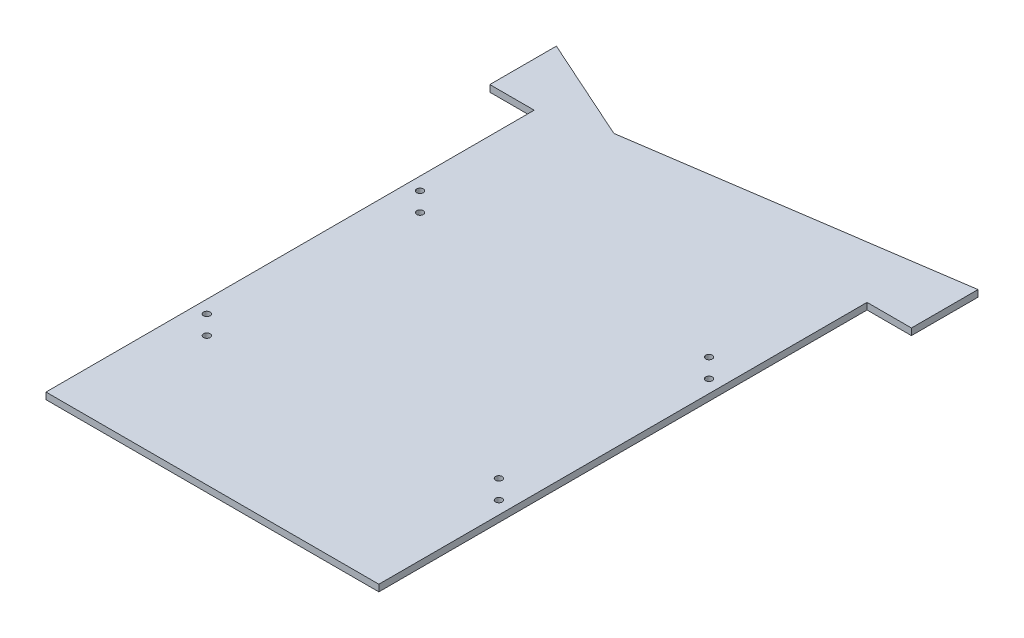
from build123d import *

# Parameters (mm, degrees)
SKETCH1_W           = 150
SKETCH1_H           = 200
SKETCH1_R           = 1.5
BOSS_EXTRUDE1_DEPTH = 3
BOSS_EXTRUDE3_DEPTH = 3


with BuildPart() as part:
    # Sketch1 → Boss-Extrude1 (new body)
    with BuildSketch(Plane(origin=(0, 0, 0), x_dir=(1, 0, 0), z_dir=(0, 1, 0))):
        Rectangle(SKETCH1_W, SKETCH1_H)
        with Locations((-69.242640687, 62.79605759)):
            Circle(SKETCH1_R, mode=Mode.SUBTRACT)
        with Locations((-60.757359313, 54.310776216)):
            Circle(SKETCH1_R, mode=Mode.SUBTRACT)
        with Locations((60.757359313, 63.034810844)):
            Circle(SKETCH1_R, mode=Mode.SUBTRACT)
        with Locations((69.242640687, 54.54952947)):
            Circle(SKETCH1_R, mode=Mode.SUBTRACT)
        with Locations((-69.242640687, -33.274226936)):
            Circle(SKETCH1_R, mode=Mode.SUBTRACT)
        with Locations((-60.757359313, -41.75950831)):
            Circle(SKETCH1_R, mode=Mode.SUBTRACT)
        with Locations((60.757359313, -31.641853854)):
            Circle(SKETCH1_R, mode=Mode.SUBTRACT)
        with Locations((69.242640687, -40.127135228)):
            Circle(SKETCH1_R, mode=Mode.SUBTRACT)
    extrude(amount=BOSS_EXTRUDE1_DEPTH)

    # Sketch2 → Boss-Extrude3 (add)
    with BuildSketch(Plane(origin=(0, 3, 0), x_dir=(1, 0, 0), z_dir=(0, 1, 0))):
        Polygon((-75, 100), (-75, 120), (-95, 120), (-95, 150), (-48, 128.895831239), (95, 150), (95, 120), (75, 120), (75, 100), align=None)
    extrude(amount=-BOSS_EXTRUDE3_DEPTH)


solid = part.part
